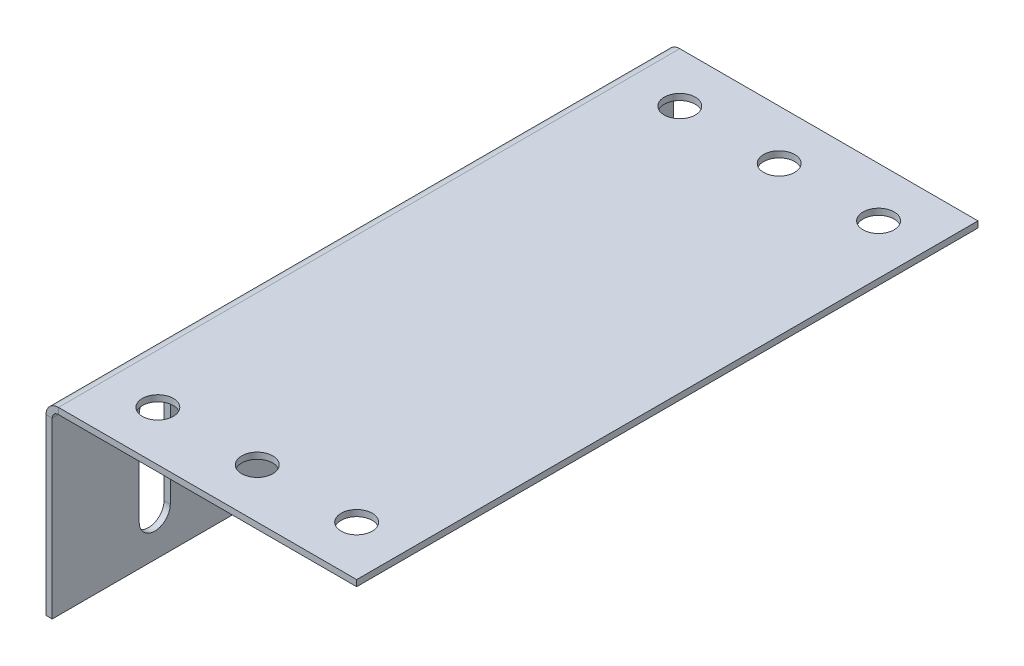
from build123d import *

# Parameters (mm, degrees)
BASE_FLANGE1_DEPTH = 100
CUT_EXTRUDE3_REACH = 117.758
SKETCH8_R          = 2.5
CUT_EXTRUDE4_REACH = 117.758
SKETCH11_R         = 2.5


# Sheet-metal steps are written as plain solids
with BuildPart() as part:
    # Sketch2 → Base-Flange1 (new body)
    with BuildSketch(Plane.XY):
        with BuildLine():
            Line((0, 0), (0, 28))
            ThreePointArc((0, 28), (0.585786438, 29.414213562), (2, 30))
            Line((2, 30), (50, 30))
            Line((50, 30), (50, 29))
            Line((50, 29), (2, 29))
            ThreePointArc((2, 29), (1.292893219, 28.707106781), (1, 28))
            Line((1, 28), (1, 0))
            Line((1, 0), (0, 0))
        make_face()
    extrude(amount=BASE_FLANGE1_DEPTH)

    # Sketch8 → Cut-Extrude3 (cut, up to next)
    with BuildSketch(Plane(origin=(0, 30, 0), x_dir=(1, 0, 0), z_dir=(0, 1, 0)), mode=Mode.PRIVATE) as cut_extrude3_sk1:
        with Locations(Location((42, -8, 0), (0, 0, 270))):
            Circle(SKETCH8_R)
    cut_extrude3_tool1 = extrude(cut_extrude3_sk1.sketch, amount=-CUT_EXTRUDE3_REACH, mode=Mode.PRIVATE) & part.part
    # Sketch8 → Cut-Extrude3 (cut, up to next)
    with BuildSketch(Plane(origin=(0, 30, 0), x_dir=(1, 0, 0), z_dir=(0, 1, 0)), mode=Mode.PRIVATE) as cut_extrude3_sk2:
        with Locations(Location((10, -8, 0), (0, 0, 270))):
            Circle(SKETCH8_R)
    cut_extrude3_tool2 = extrude(cut_extrude3_sk2.sketch, amount=-CUT_EXTRUDE3_REACH, mode=Mode.PRIVATE) & part.part
    # Sketch8 → Cut-Extrude3 (cut, up to next)
    with BuildSketch(Plane(origin=(0, 30, 0), x_dir=(1, 0, 0), z_dir=(0, 1, 0)), mode=Mode.PRIVATE) as cut_extrude3_sk3:
        with Locations(Location((42, -92, 0), (0, 0, 270))):
            Circle(SKETCH8_R)
    cut_extrude3_tool3 = extrude(cut_extrude3_sk3.sketch, amount=-CUT_EXTRUDE3_REACH, mode=Mode.PRIVATE) & part.part
    # Sketch8 → Cut-Extrude3 (cut, up to next)
    with BuildSketch(Plane(origin=(0, 30, 0), x_dir=(1, 0, 0), z_dir=(0, 1, 0)), mode=Mode.PRIVATE) as cut_extrude3_sk4:
        with Locations(Location((10, -92, 0), (0, 0, 270))):
            Circle(SKETCH8_R)
    cut_extrude3_tool4 = extrude(cut_extrude3_sk4.sketch, amount=-CUT_EXTRUDE3_REACH, mode=Mode.PRIVATE) & part.part
    # Sketch8 → Cut-Extrude3 (cut, up to next)
    with BuildSketch(Plane(origin=(0, 30, 0), x_dir=(1, 0, 0), z_dir=(0, 1, 0)), mode=Mode.PRIVATE) as cut_extrude3_sk5:
        with Locations(Location((26, -8, 0), (0, 0, 270))):
            Circle(SKETCH8_R)
    cut_extrude3_tool5 = extrude(cut_extrude3_sk5.sketch, amount=-CUT_EXTRUDE3_REACH, mode=Mode.PRIVATE) & part.part
    # Sketch8 → Cut-Extrude3 (cut, up to next)
    with BuildSketch(Plane(origin=(0, 30, 0), x_dir=(1, 0, 0), z_dir=(0, 1, 0)), mode=Mode.PRIVATE) as cut_extrude3_sk6:
        with Locations(Location((26, -92, 0), (0, 0, 270))):
            Circle(SKETCH8_R)
    cut_extrude3_tool6 = extrude(cut_extrude3_sk6.sketch, amount=-CUT_EXTRUDE3_REACH, mode=Mode.PRIVATE) & part.part
    add(cut_extrude3_tool1.solids().sort_by_distance((42, 30, 8))[0], mode=Mode.SUBTRACT)
    add(cut_extrude3_tool2.solids().sort_by_distance((10, 30, 8))[0], mode=Mode.SUBTRACT)
    add(cut_extrude3_tool3.solids().sort_by_distance((42, 30, 92))[0], mode=Mode.SUBTRACT)
    add(cut_extrude3_tool4.solids().sort_by_distance((10, 30, 92))[0], mode=Mode.SUBTRACT)
    add(cut_extrude3_tool5.solids().sort_by_distance((26, 30, 8))[0], mode=Mode.SUBTRACT)
    add(cut_extrude3_tool6.solids().sort_by_distance((26, 30, 92))[0], mode=Mode.SUBTRACT)

    # Sketch11 → Cut-Extrude4 (cut, up to next)
    with BuildSketch(Plane.ZY, mode=Mode.PRIVATE) as cut_extrude4_sk1:
        with BuildLine():
            ThreePointArc((19, 21.5), (16.5, 24), (14, 21.5))
            Line((14, 21.5), (14, 13.999999995))
            ThreePointArc((14, 13.999999995), (16.499999997, 16.5), (19, 14))
            Line((19, 14), (19, 21.5))
        make_face()
    cut_extrude4_tool1 = extrude(cut_extrude4_sk1.sketch, amount=-CUT_EXTRUDE4_REACH, mode=Mode.PRIVATE) & part.part
    # Sketch11 → Cut-Extrude4 (cut, up to next)
    with BuildSketch(Plane.ZY, mode=Mode.PRIVATE) as cut_extrude4_sk2:
        with BuildLine():
            ThreePointArc((19, 14), (16.500000003, 11.5), (14, 13.999999995))
            Line((14, 13.999999995), (14, 6.5))
            ThreePointArc((14, 6.5), (16.5, 4), (19, 6.5))
            Line((19, 6.5), (19, 14))
        make_face()
    cut_extrude4_tool2 = extrude(cut_extrude4_sk2.sketch, amount=-CUT_EXTRUDE4_REACH, mode=Mode.PRIVATE) & part.part
    # Sketch11 → Cut-Extrude4 (cut, up to next)
    with BuildSketch(Plane.ZY, mode=Mode.PRIVATE) as cut_extrude4_sk3:
        with Locations((16.5, 14)):
            Circle(SKETCH11_R)
    cut_extrude4_tool3 = extrude(cut_extrude4_sk3.sketch, amount=-CUT_EXTRUDE4_REACH, mode=Mode.PRIVATE) & part.part
    # Sketch11 → Cut-Extrude4 (cut, up to next)
    with BuildSketch(Plane.ZY, mode=Mode.PRIVATE) as cut_extrude4_sk4:
        with BuildLine():
            ThreePointArc((39, 14), (36.5, 11.5), (34, 14))
            Line((34, 14), (34, 6.5))
            ThreePointArc((34, 6.5), (36.5, 4), (39, 6.5))
            Line((39, 6.5), (39, 14))
        make_face()
    cut_extrude4_tool4 = extrude(cut_extrude4_sk4.sketch, amount=-CUT_EXTRUDE4_REACH, mode=Mode.PRIVATE) & part.part
    # Sketch11 → Cut-Extrude4 (cut, up to next)
    with BuildSketch(Plane.ZY, mode=Mode.PRIVATE) as cut_extrude4_sk5:
        with Locations((36.5, 14)):
            Circle(SKETCH11_R)
    cut_extrude4_tool5 = extrude(cut_extrude4_sk5.sketch, amount=-CUT_EXTRUDE4_REACH, mode=Mode.PRIVATE) & part.part
    # Sketch11 → Cut-Extrude4 (cut, up to next)
    with BuildSketch(Plane.ZY, mode=Mode.PRIVATE) as cut_extrude4_sk6:
        with BuildLine():
            ThreePointArc((39, 21.5), (36.5, 24), (34, 21.5))
            Line((34, 21.5), (34, 14))
            ThreePointArc((34, 14), (36.5, 16.5), (39, 14))
            Line((39, 14), (39, 21.5))
        make_face()
    cut_extrude4_tool6 = extrude(cut_extrude4_sk6.sketch, amount=-CUT_EXTRUDE4_REACH, mode=Mode.PRIVATE) & part.part
    # Sketch11 → Cut-Extrude4 (cut, up to next)
    with BuildSketch(Plane.ZY, mode=Mode.PRIVATE) as cut_extrude4_sk7:
        with BuildLine():
            Line((86, 14), (86, 21.5))
            ThreePointArc((86, 21.5), (83.5, 24), (81, 21.5))
            Line((81, 21.5), (81, 14))
            ThreePointArc((81, 14), (83.5, 16.5), (86, 14))
        make_face()
    cut_extrude4_tool7 = extrude(cut_extrude4_sk7.sketch, amount=-CUT_EXTRUDE4_REACH, mode=Mode.PRIVATE) & part.part
    # Sketch11 → Cut-Extrude4 (cut, up to next)
    with BuildSketch(Plane.ZY, mode=Mode.PRIVATE) as cut_extrude4_sk8:
        with BuildLine():
            Line((86, 6.5), (86, 14))
            ThreePointArc((86, 14), (83.5, 11.5), (81, 14))
            Line((81, 14), (81, 6.5))
            ThreePointArc((81, 6.5), (83.5, 4), (86, 6.5))
        make_face()
    cut_extrude4_tool8 = extrude(cut_extrude4_sk8.sketch, amount=-CUT_EXTRUDE4_REACH, mode=Mode.PRIVATE) & part.part
    # Sketch11 → Cut-Extrude4 (cut, up to next)
    with BuildSketch(Plane.ZY, mode=Mode.PRIVATE) as cut_extrude4_sk9:
        with Locations((83.5, 14)):
            Circle(SKETCH11_R)
    cut_extrude4_tool9 = extrude(cut_extrude4_sk9.sketch, amount=-CUT_EXTRUDE4_REACH, mode=Mode.PRIVATE) & part.part
    # Sketch11 → Cut-Extrude4 (cut, up to next)
    with BuildSketch(Plane.ZY, mode=Mode.PRIVATE) as cut_extrude4_sk10:
        with BuildLine():
            ThreePointArc((66, 21.5), (63.5, 24), (61, 21.5))
            Line((61, 21.5), (61, 14))
            ThreePointArc((61, 14), (63.5, 16.5), (66, 14))
            Line((66, 14), (66, 21.5))
        make_face()
    cut_extrude4_tool10 = extrude(cut_extrude4_sk10.sketch, amount=-CUT_EXTRUDE4_REACH, mode=Mode.PRIVATE) & part.part
    # Sketch11 → Cut-Extrude4 (cut, up to next)
    with BuildSketch(Plane.ZY, mode=Mode.PRIVATE) as cut_extrude4_sk11:
        with Locations((63.5, 14)):
            Circle(SKETCH11_R)
    cut_extrude4_tool11 = extrude(cut_extrude4_sk11.sketch, amount=-CUT_EXTRUDE4_REACH, mode=Mode.PRIVATE) & part.part
    # Sketch11 → Cut-Extrude4 (cut, up to next)
    with BuildSketch(Plane.ZY, mode=Mode.PRIVATE) as cut_extrude4_sk12:
        with BuildLine():
            ThreePointArc((66, 14), (63.5, 11.5), (61, 14))
            Line((61, 14), (61, 6.5))
            ThreePointArc((61, 6.5), (63.5, 4), (66, 6.5))
            Line((66, 6.5), (66, 14))
        make_face()
    cut_extrude4_tool12 = extrude(cut_extrude4_sk12.sketch, amount=-CUT_EXTRUDE4_REACH, mode=Mode.PRIVATE) & part.part
    add(cut_extrude4_tool1.solids().sort_by_distance((0, 19.713495, 16.5))[0], mode=Mode.SUBTRACT)
    add(cut_extrude4_tool2.solids().sort_by_distance((0, 8.286505, 16.5))[0], mode=Mode.SUBTRACT)
    add(cut_extrude4_tool3.solids().sort_by_distance((0, 14, 16.5))[0], mode=Mode.SUBTRACT)
    add(cut_extrude4_tool4.solids().sort_by_distance((0, 8.286505, 36.5))[0], mode=Mode.SUBTRACT)
    add(cut_extrude4_tool5.solids().sort_by_distance((0, 14, 36.5))[0], mode=Mode.SUBTRACT)
    add(cut_extrude4_tool6.solids().sort_by_distance((0, 19.713495, 36.5))[0], mode=Mode.SUBTRACT)
    add(cut_extrude4_tool7.solids().sort_by_distance((0, 19.713495, 83.5))[0], mode=Mode.SUBTRACT)
    add(cut_extrude4_tool8.solids().sort_by_distance((0, 8.286505, 83.5))[0], mode=Mode.SUBTRACT)
    add(cut_extrude4_tool9.solids().sort_by_distance((0, 14, 83.5))[0], mode=Mode.SUBTRACT)
    add(cut_extrude4_tool10.solids().sort_by_distance((0, 19.713495, 63.5))[0], mode=Mode.SUBTRACT)
    add(cut_extrude4_tool11.solids().sort_by_distance((0, 14, 63.5))[0], mode=Mode.SUBTRACT)
    add(cut_extrude4_tool12.solids().sort_by_distance((0, 8.286505, 63.5))[0], mode=Mode.SUBTRACT)


solid = part.part
